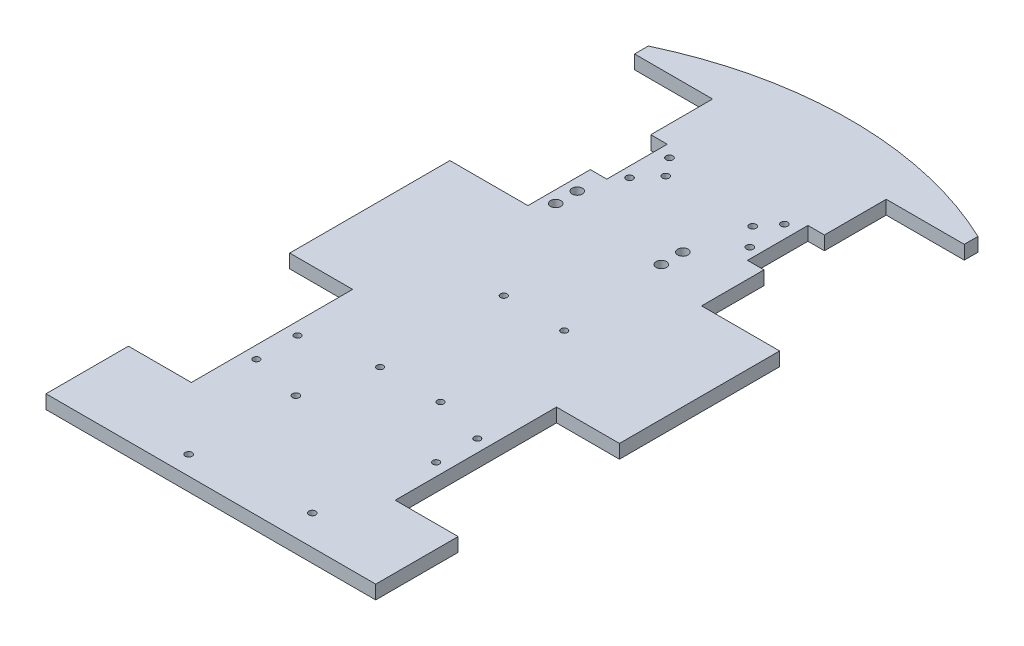
from build123d import *

# Parameters (mm, degrees)
CHASSIS_DEPTH      = 6.35
SKETCH2_R          = 1.5875
SKETCH2_R_2        = 2.38125
SKETCH2_R_3        = 1.5
CUT_EXTRUDE1_DEPTH = 17.78


with BuildPart() as part:
    # Sketch1 → Chassis (new body)
    with BuildSketch(Plane(origin=(0, 0, 0), x_dir=(1, 0, 0), z_dir=(0, 1, 0))):
        with BuildLine():
            ThreePointArc((76.2, 49.022), (39.053241005, 61.832834411), (0, 66.173750115))
            Line((0, 66.173750115), (0, -229.362))
            Line((0, -229.362), (76.2, -229.362))
            Line((76.2, -229.362), (76.2, -191.262))
            Line((76.2, -191.262), (47.117, -191.262))
            Line((47.117, -191.262), (47.117, -116.713))
            Line((47.117, -116.713), (76.2, -116.713))
            Line((76.2, -116.713), (76.2, -42.672))
            Line((76.2, -42.672), (40.132, -42.672))
            Line((40.132, -42.672), (40.132, -13.843))
            Line((40.132, -13.843), (32.512, -13.843))
            Line((32.512, -13.843), (32.512, 14.097))
            Line((32.512, 14.097), (40.132, 14.097))
            Line((40.132, 14.097), (40.132, 42.672))
            Line((40.132, 42.672), (76.2, 42.672))
            Line((76.2, 42.672), (76.2, 49.022))
        make_face()
    chassis = extrude(amount=CHASSIS_DEPTH)

    # Mirror1: Chassis across plane
    add(chassis.mirror(Plane(origin=(0, 6.35, 0), x_dir=(0, 0, 1), z_dir=(1, 0, 0))))

    # Sketch2 → Cut-Extrude1 (cut)
    with BuildSketch(Plane(origin=(0, 0, 0), x_dir=(1, 0, 0), z_dir=(0, 1, 0))):
        with Locations((-17.703140953, -172.359887538)):
            Circle(SKETCH2_R)
        with Locations((-18.973140953, -220.619887538)):
            Circle(SKETCH2_R)
        with Locations((33.096859047, -215.539887538)):
            Circle(SKETCH2_R)
        with Locations((-26.555704526, 9.169971692)):
            Circle(SKETCH2_R)
        with Locations((-20.105647723, 0.999384842)):
            Circle(SKETCH2_R)
        with Locations((-27.786476371, -8.040568412)):
            Circle(SKETCH2_R)
        with Locations((26.555704526, 9.169971692)):
            Circle(SKETCH2_R)
        with Locations((20.105647723, 0.999384842)):
            Circle(SKETCH2_R)
        with Locations((27.786476371, -8.040568412)):
            Circle(SKETCH2_R)
        with Locations((14.2672, -25.46003476)):
            Circle(SKETCH2_R_2)
        with Locations((14.2672, -35.42953476)):
            Circle(SKETCH2_R_2)
        with Locations((-34.5516, -25.46003476)):
            Circle(SKETCH2_R_2)
        with Locations((-34.5516, -35.42953476)):
            Circle(SKETCH2_R_2)
        with Locations((18.288, -84.328)):
            Circle(SKETCH2_R_3)
        with Locations((-9.652, -84.328)):
            Circle(SKETCH2_R_3)
        with Locations((18.288, -141.478)):
            Circle(SKETCH2_R_3)
        with Locations((-9.652, -141.478)):
            Circle(SKETCH2_R_3)
        with Locations((-41.402, -147.875000023)):
            Circle(SKETCH2_R_3)
        with Locations((-41.402, -166.925000023)):
            Circle(SKETCH2_R_3)
        with Locations((41.402, -147.605334461)):
            Circle(SKETCH2_R_3)
        with Locations((41.402, -166.655334461)):
            Circle(SKETCH2_R_3)
    extrude(amount=CUT_EXTRUDE1_DEPTH, mode=Mode.SUBTRACT)


solid = part.part
